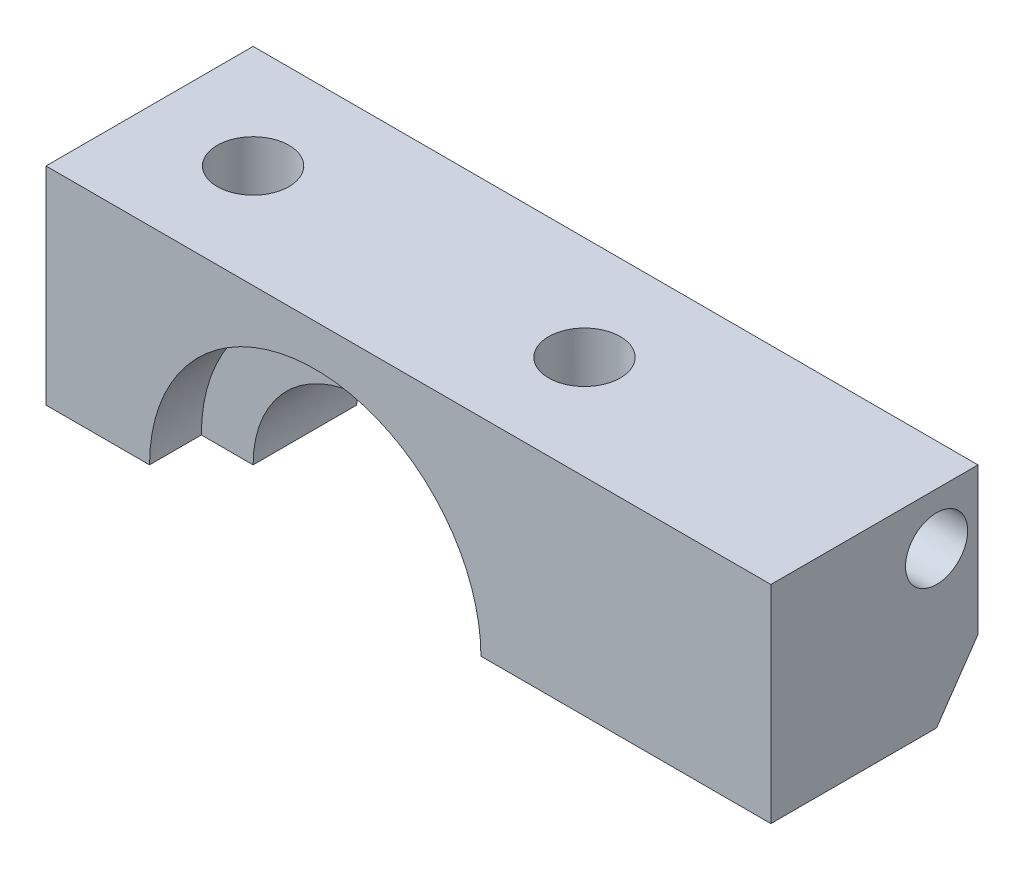
from build123d import *

# Parameters (mm, degrees)
RESSALTO_EXTRUS_O1_DEPTH = 2.5
RESSALTO_EXTRUS_O2_DEPTH = 5
ESBO_O2_R                = 1.730913938
CORTE_EXTRUS_O1_DEPTH    = 15
ESBO_O5_R                = 1.5
RESSALTO_EXTRUS_O4_DEPTH = 9


with BuildPart() as part:
    # Esboço1 → Ressalto-extrusão1 (new, symmetric)
    with BuildSketch(Plane.XY):
        with BuildLine():
            Line((-5.5, 0), (-13, 0))
            Line((-13, 0), (-13, 10))
            Line((-13, 10), (13, 10))
            Line((13, 10), (13, 0))
            Line((13, 0), (5.5, 0))
            ThreePointArc((5.5, 0), (0, 5.5), (-5.5, 0))
        make_face()
    extrude(amount=RESSALTO_EXTRUS_O1_DEPTH, both=True)

    # Esboço3 → Ressalto-extrusão2 (add, symmetric)
    with BuildSketch(Plane.XY):
        with BuildLine():
            Line((-13, 10), (-13, 0))
            Line((-13, 0), (-8, 0))
            ThreePointArc((-8, 0), (0, 8), (8, 0))
            Line((8, 0), (13, 0))
            Line((13, 0), (13, 10))
            Line((13, 10), (-13, 10))
        make_face()
    extrude(amount=RESSALTO_EXTRUS_O2_DEPTH, both=True)

    # Esboço2 → Corte-extrusão1 (cut)
    with BuildSketch(Plane.XZ):
        with Locations((-8, 0)):
            Circle(ESBO_O2_R)
        with Locations((8, 0)):
            Circle(ESBO_O2_R)
    extrude(amount=-CORTE_EXTRUS_O1_DEPTH, mode=Mode.SUBTRACT)

    # Esboço5 → Ressalto-extrusão4 (add)
    with BuildSketch(Plane(origin=(13, 0, 0), x_dir=(0, 0, -1), z_dir=(1, 0, 0))):
        Polygon((-5, 10), (-5, 0), (3, 0), (5, 2.913141301), (5, 10), align=None)
        with Locations((3, 7.5)):
            Circle(ESBO_O5_R, mode=Mode.SUBTRACT)
    extrude(amount=RESSALTO_EXTRUS_O4_DEPTH)


solid = part.part
